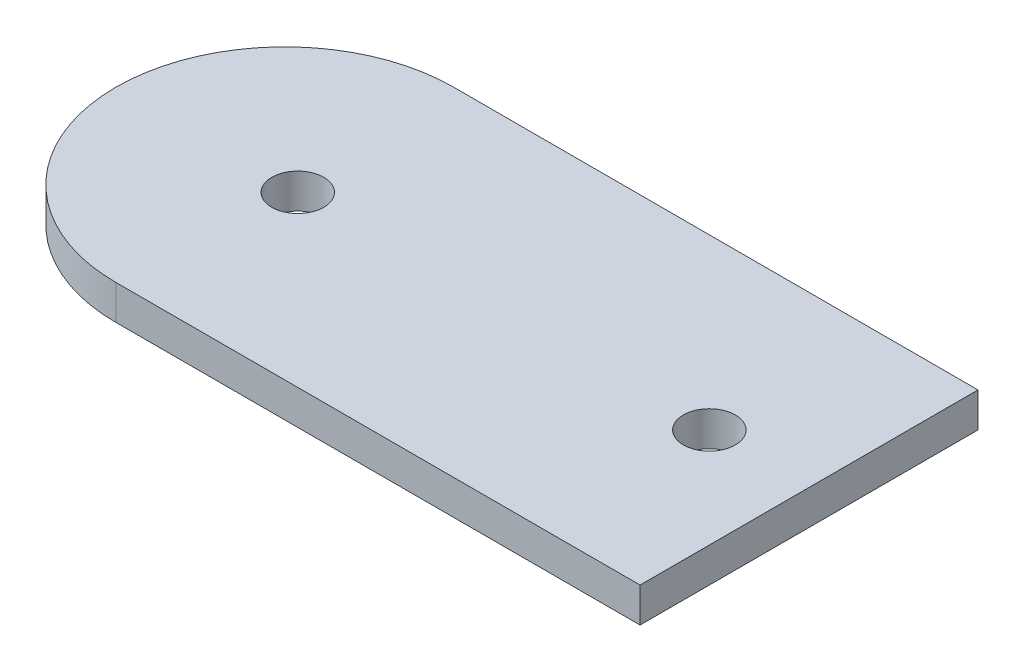
from build123d import *

# Parameters (mm, degrees)
SKETCH1_W           = 40
SKETCH1_H           = 19.5
SKETCH1_R           = 1.5
BOSS_EXTRUDE1_DEPTH = 2
FILLET1_R           = 9.75


with BuildPart() as part:
    # Sketch1 → Boss-Extrude1 (new body)
    with BuildSketch(Plane(origin=(0, 0, 0), x_dir=(1, 0, 0), z_dir=(0, 1, 0))):
        Rectangle(SKETCH1_W, SKETCH1_H)
        with Locations(Location((-9.5, 0, 0), (0, 0, 270))):
            Circle(SKETCH1_R, mode=Mode.SUBTRACT)
        with Locations(Location((14.25, 0, 0), (0, 0, 270))):
            Circle(SKETCH1_R, mode=Mode.SUBTRACT)
    extrude(amount=BOSS_EXTRUDE1_DEPTH)

    # Fillet1
    fillet1_edges = [part.edges().sort_by_distance(p)[0] for p in [
        (-20, 1, -9.75),
        (-20, 1, 9.75),
    ]]
    fillet(fillet1_edges, radius=FILLET1_R - 0.0001)  # a hair under: the kernel refuses the full size


solid = part.part
